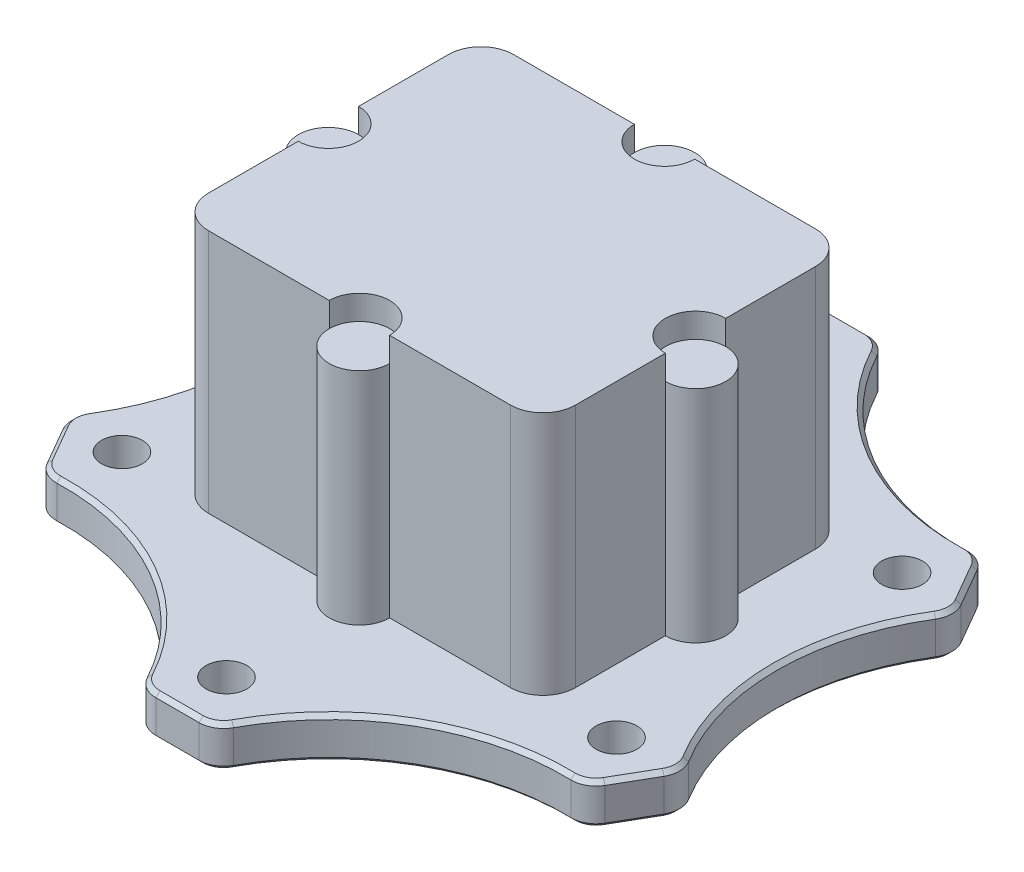
from build123d import *

# Parameters (mm, degrees)
BOSS_EXTRUDE1_DEPTH    = 5
F_10_CLEARANCE_HOLE1_D = 5
FILLET1_R              = 3
CHAMFER1_SIZE          = 0.5
BOSS_EXTRUDE4_DEPTH    = 30
SKETCH5_R              = 3.7
BOSS_EXTRUDE5_DEPTH    = 27


with BuildPart() as part:
    # Sketch1 → Boss-Extrude1 (new body)
    with BuildSketch(Plane.XZ.offset(-227)):
        with BuildLine():
            Line((610.472328875, 48.998023491), (619.472328875, 48.998023491))
            ThreePointArc((619.472328875, 48.998023491), (631.222328875, 61.852197868), (648.22937043, 65.600909174))
            Line((648.22937043, 65.600909174), (652.72937043, 73.395137808))
            ThreePointArc((652.72937043, 73.395137808), (647.472328875, 89.998023491), (652.72937043, 106.600909174))
            Line((652.72937043, 106.600909174), (648.22937043, 114.395137808))
            ThreePointArc((648.22937043, 114.395137808), (631.222328875, 118.143849114), (619.472328875, 130.998023491))
            Line((619.472328875, 130.998023491), (610.472328875, 130.998023491))
            ThreePointArc((610.472328875, 130.998023491), (598.722328875, 118.143849114), (581.71528732, 114.395137808))
            Line((581.71528732, 114.395137808), (577.21528732, 106.600909174))
            ThreePointArc((577.21528732, 106.600909174), (582.472328875, 89.998023491), (577.21528732, 73.395137808))
            Line((577.21528732, 73.395137808), (581.71528732, 65.600909174))
            ThreePointArc((581.71528732, 65.600909174), (598.722328875, 61.852197868), (610.472328875, 48.998023491))
        make_face()
    extrude(amount=-BOSS_EXTRUDE1_DEPTH)

    # #10 Clearance Hole1 (through all)
    with Locations(Plane(origin=(0, 232, 0), x_dir=(1, 0, 0), z_dir=(0, 1, 0))):
        with Locations((614.972328875, -124.998023491), (584.661439743, -72.498023491), (584.661439743, -107.498023491), (614.972328875, -54.998023491), (645.283218008, -107.498023491), (645.283218008, -72.498023491)):
            Hole(F_10_CLEARANCE_HOLE1_D / 2)

    # Fillet1
    fillet1_edges = [part.edges().sort_by_distance(p)[0] for p in [
        (652.72937043, 229.5, 106.600909174),
        (577.21528732, 229.5, 106.600909174),
        (581.71528732, 229.5, 65.600909174),
        (648.22937043, 229.5, 65.600909174),
        (652.72937043, 229.5, 73.395137808),
        (619.472328875, 229.5, 130.998023491),
        (648.22937043, 229.5, 114.395137808),
        (619.472328875, 229.5, 48.998023491),
        (577.21528732, 229.5, 73.395137808),
        (610.472328875, 229.5, 48.998023491),
        (610.472328875, 229.5, 130.998023491),
        (581.71528732, 229.5, 114.395137808),
    ]]
    fillet(fillet1_edges, radius=FILLET1_R)

    # Chamfer1
    chamfer1_edges = [part.edges().sort_by_distance(p)[0] for p in [
        (648.01941096, 232, 66.084554366),
        (650.47937043, 232, 69.498023491),
        (631.222328875, 232, 61.852197868),
        (652.205541673, 232, 73.335145448),
        (619.158459588, 232, 49.421676322),
        (647.472328875, 232, 89.998023491),
        (614.972328875, 232, 48.998023491),
        (652.205541673, 232, 106.660901535),
        (610.786198162, 232, 49.421676322),
        (650.47937043, 232, 110.498023491),
        (598.722328875, 232, 61.852197868),
        (648.01941096, 232, 113.911492617),
        (581.92524679, 232, 66.084554366),
        (631.222328875, 232, 118.143849114),
        (579.46528732, 232, 69.498023491),
        (619.158459588, 232, 130.57437066),
        (577.739116077, 232, 73.335145448),
        (614.972328875, 232, 130.998023491),
        (582.472328875, 232, 89.998023491),
        (610.786198162, 232, 130.57437066),
        (577.739116077, 232, 106.660901535),
        (598.722328875, 232, 118.143849114),
        (579.46528732, 232, 110.498023491),
        (581.92524679, 232, 113.911492617),
        (631.222328875, 227, 118.143849114),
        (619.158459588, 227, 130.57437066),
        (648.01941096, 227, 113.911492617),
        (614.972328875, 227, 130.998023491),
        (650.47937043, 227, 110.498023491),
        (610.786198162, 227, 130.57437066),
        (652.205541673, 227, 106.660901535),
        (598.722328875, 227, 118.143849114),
        (647.472328875, 227, 89.998023491),
        (581.92524679, 227, 113.911492617),
        (652.205541673, 227, 73.335145448),
        (579.46528732, 227, 110.498023491),
        (650.47937043, 227, 69.498023491),
        (577.739116077, 227, 106.660901535),
        (648.01941096, 227, 66.084554366),
        (582.472328875, 227, 89.998023491),
        (631.222328875, 227, 61.852197868),
        (577.739116077, 227, 73.335145448),
        (619.158459588, 227, 49.421676322),
        (579.46528732, 227, 69.498023491),
        (614.972328875, 227, 48.998023491),
        (581.92524679, 227, 66.084554366),
        (610.786198162, 227, 49.421676322),
        (598.722328875, 227, 61.852197868),
    ]]
    chamfer(chamfer1_edges, length=CHAMFER1_SIZE)

    # Sketch4 → Boss-Extrude4 (add)
    with BuildSketch(Plane(origin=(0, 232, 0), x_dir=(1, 0, 0), z_dir=(0, 1, 0))):
        with BuildLine():
            ThreePointArc((611.272328875, -108.698023491), (614.972328875, -104.998023491), (618.672328875, -108.698023491))
            Line((618.672328875, -108.698023491), (633.472328875, -108.698023491))
            ThreePointArc((633.472328875, -108.698023491), (636.300756, -107.526450616), (637.472328875, -104.698023491))
            Line((637.472328875, -104.698023491), (637.472328875, -93.698023491))
            ThreePointArc((637.472328875, -93.698023491), (633.772328875, -89.998023491), (637.472328875, -86.298023491))
            Line((637.472328875, -86.298023491), (637.472328875, -75.298023491))
            ThreePointArc((637.472328875, -75.298023491), (636.300756, -72.469596366), (633.472328875, -71.298023491))
            Line((633.472328875, -71.298023491), (618.672328875, -71.298023491))
            ThreePointArc((618.672328875, -71.298023491), (614.972328875, -74.998023491), (611.272328875, -71.298023491))
            Line((611.272328875, -71.298023491), (596.472328875, -71.298023491))
            ThreePointArc((596.472328875, -71.298023491), (593.64390175, -72.469596366), (592.472328875, -75.298023491))
            Line((592.472328875, -75.298023491), (592.472328875, -86.298023491))
            ThreePointArc((592.472328875, -86.298023491), (595.088623966, -87.381728401), (596.172328875, -89.998023491))
            ThreePointArc((596.172328875, -89.998023491), (595.088623966, -92.614318581), (592.472328875, -93.698023491))
            Line((592.472328875, -93.698023491), (592.472328875, -104.698023491))
            ThreePointArc((592.472328875, -104.698023491), (593.64390175, -107.526450616), (596.472328875, -108.698023491))
            Line((596.472328875, -108.698023491), (611.272328875, -108.698023491))
        make_face()
    extrude(amount=BOSS_EXTRUDE4_DEPTH)

    # Sketch5 → Boss-Extrude5 (add)
    with BuildSketch(Plane(origin=(0, 232, 0), x_dir=(1, 0, 0), z_dir=(0, 1, 0))):
        with Locations((614.972328875, -71.298023491)):
            Circle(SKETCH5_R)
        with Locations((637.472328875, -89.998023491)):
            Circle(SKETCH5_R)
        with Locations((614.972328875, -108.698023491)):
            Circle(SKETCH5_R)
        with Locations((592.472328875, -89.998023491)):
            Circle(SKETCH5_R)
    extrude(amount=BOSS_EXTRUDE5_DEPTH)


solid = part.part
